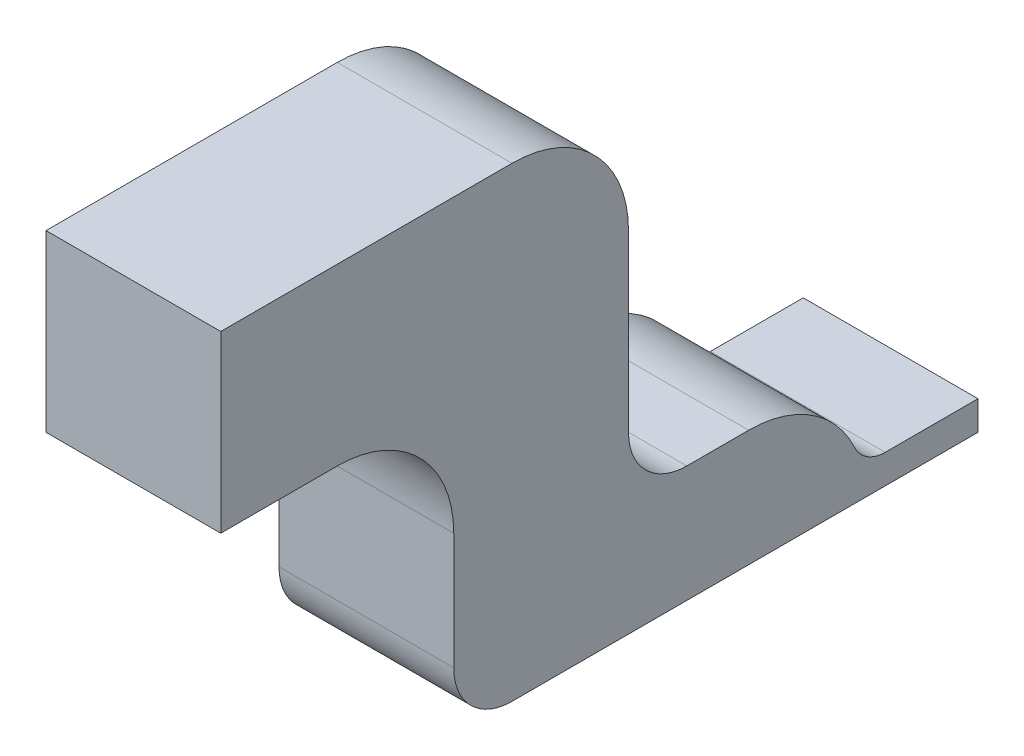
from build123d import *

# Parameters (mm, degrees)
ESQUISSE1_W        = 0.3
ESQUISSE1_H        = 0.7
BOSS_EXTRU_1_DEPTH = 0.2
ESQUISSE2_W        = 0.3
ESQUISSE2_H        = 0.3
BOSS_EXTRU_2_DEPTH = 0.6
ESQUISSE3_W        = 0.3
ESQUISSE3_H        = 0.3
BOSS_EXTRU_3_DEPTH = 0.4
CONG_1_R           = 0.2
CONG_2_R           = 0.1
ESQUISSE4_W        = 0.3
ESQUISSE4_H        = 0.05
BOSS_EXTRU_4_DEPTH = 0.2
CONG_6_R           = 0.2
CONG_7_R           = 0.058


with BuildPart() as part:
    # Esquisse1 → Boss.-Extru.1 (new body)
    with BuildSketch(Plane(origin=(0, 0, 0), x_dir=(1, 0, 0), z_dir=(0, 1, 0))):
        with Locations((0.15, 0.35)):
            Rectangle(ESQUISSE1_W, ESQUISSE1_H)
    extrude(amount=BOSS_EXTRU_1_DEPTH)

    # Esquisse2 → Boss.-Extru.2 (add)
    with BuildSketch(Plane(origin=(0, 0.2, 0), x_dir=(1, 0, 0), z_dir=(0, 1, 0))):
        with Locations((0.15, 0.15)):
            Rectangle(ESQUISSE2_W, ESQUISSE2_H)
    extrude(amount=BOSS_EXTRU_2_DEPTH)

    # Esquisse3 → Boss.-Extru.3 (add)
    with BuildSketch(Plane.XY):
        with Locations((0.15, 0.65)):
            Rectangle(ESQUISSE3_W, ESQUISSE3_H)
    extrude(amount=BOSS_EXTRU_3_DEPTH)

    # Congé1
    cong_1_edges = [part.edges().sort_by_distance(p)[0] for p in [
        (0.15, 0.8, -0.3),
        (0.15, 0.5, 0),
    ]]
    fillet(cong_1_edges, radius=CONG_1_R)

    # Congé2
    cong_2_edges = [part.edges().sort_by_distance(p)[0] for p in [
        (0.15, 0.2, -0.3),
        (0.15, 0, 0),
    ]]
    fillet(cong_2_edges, radius=CONG_2_R)

    # Esquisse4 → Boss.-Extru.4 (add)
    with BuildSketch(Plane(origin=(0, 0, -0.7), x_dir=(-1, 0, 0), z_dir=(0, 0, -1))):
        with Locations((-0.15, 0.025)):
            Rectangle(ESQUISSE4_W, ESQUISSE4_H)
    extrude(amount=BOSS_EXTRU_4_DEPTH)

    # Congé6
    # the kernel refuses this fillet: 0.2 mm, written as the material it takes off along each edge
    with BuildSketch(Plane(origin=(0.784122918, 0.2, -0.7), x_dir=(0, -1.0, 3.7700213321171e-11), z_dir=(-1, 0, 0))) as cong_6_piece_1:
        with BuildLine():
            CenterArc((0.2, 0.193649167), CONG_6_R, 179.999999998, 75.522487815)
            Line((0, 0.193649167), (-0.004, 0.193649167))
            Line((-0.004, 0.193649167), (-0.004, 0))
            Line((-0.004, 0), (0, -0.004))
            ThreePointArc((0, -0.004), (0.075, -0.004), (0.149, -0.003872983))
            Line((0.149, -0.003872983), (0.15, 0))
        make_face()
    extrude(amount=1.268245837, mode=Mode.SUBTRACT)

    # Congé7
    cong_7_edges = [part.edges().sort_by_distance(p)[0] for p in [
        (0.15, 0.05, -0.7),
    ]]
    fillet(cong_7_edges, radius=CONG_7_R)


solid = part.part
